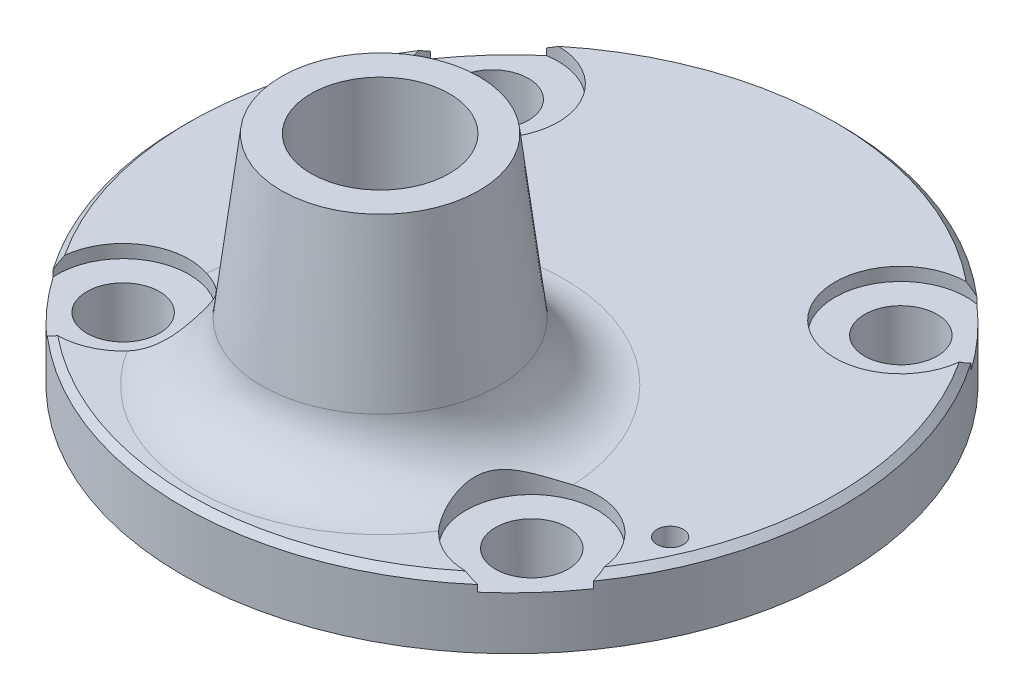
from build123d import *

# Parameters (mm, degrees)
SKETCH_1_R               = 50
EXTRUDE_1_DEPTH          = 10
FILLET_1_R               = 10
F_1_UN_DEPTH             = 79.0320447
F_1_UN_DEPTH_BACK        = 2
SKETCH_2_R               = 10
SKETCH_2_R_2             = 5.5
CUT_EXTRUDE_3_DEPTH      = 79.0320447
CUT_EXTRUDE_3_DEPTH_BACK = 79.0320447
SKETCH_2_3_R             = 5.5
SKETCH_6_R               = 10.5
CUT_EXTRUDE_4_DEPTH      = 83.758685345
SKETCH_7_R               = 2
CUT_EXTRUDE_6_DEPTH      = 83.758685345
CUT_EXTRUDE_7_DEPTH      = 4
SWEEP_1_OUTLINE_W        = 1.5
SWEEP_1_OUTLINE_H        = 22.476650491
CHAMFER_2_SIZE           = 1


# Read off the part's stored shape, not the designer's step: 切除-扫描1
with BuildPart() as part:
    # 草图1 → 凸台-拉伸1 (new body)
    with BuildSketch(Plane(origin=(0, 0, 0), x_dir=(1, 0, 0), z_dir=(0, 1, 0))):
        with Locations(Location((0, 0, 0), (0, 0, 270))):
            Circle(SKETCH_1_R)
    extrude(amount=EXTRUDE_1_DEPTH)

    # 草图5 → 旋转1 (revolve)
    with BuildSketch(Plane(origin=(0, 0, 0), x_dir=(0, 0, -1), z_dir=(1, 0, 0))):
        Polygon((-20, 10), (-20, 43), (-35, 43), (-39, 10), align=None)
    revolve(axis=Axis((0, 37.278151035, 20), (0, -1, 0)))

    # 圆角1
    fillet_1_edges = [part.edges().sort_by_distance(p)[0] for p in [
        (0, 10, 1),
    ]]
    fillet(fillet_1_edges, radius=FILLET_1_R)

    # 草图2 → 切除-拉伸1 un (cut, two sides: drawn at the far end of the back side and taken through both)
    # profile 1 of 4: a face of its own
    with BuildSketch(Plane(origin=(0, 10, 0), x_dir=(1, 0, 0), z_dir=(0, 1, 0)).offset(-F_1_UN_DEPTH_BACK)):
        with Locations((31, 28)):
            Circle(SKETCH_2_R)
        with Locations(Location((31, 28, 0), (0, 0, 270))):
            Circle(SKETCH_2_R_2, mode=Mode.SUBTRACT)
    # profile 2 of 4: a face of its own
    with BuildSketch(Plane(origin=(0, 10, 0), x_dir=(1, 0, 0), z_dir=(0, 1, 0)).offset(-F_1_UN_DEPTH_BACK)):
        with Locations((-31, 28)):
            Circle(SKETCH_2_R)
        with Locations(Location((-31, 28, 0), (0, 0, 90))):
            Circle(SKETCH_2_R_2, mode=Mode.SUBTRACT)
    # profile 3 of 4: a face of its own
    with BuildSketch(Plane(origin=(0, 10, 0), x_dir=(1, 0, 0), z_dir=(0, 1, 0)).offset(-F_1_UN_DEPTH_BACK)):
        with Locations((-31, -28)):
            Circle(SKETCH_2_R)
        with Locations(Location((-31, -28, 0), (0, 0, 52.073353544))):
            Circle(SKETCH_2_R_2, mode=Mode.SUBTRACT)
    # profile 4 of 4: a face of its own
    with BuildSketch(Plane(origin=(0, 10, 0), x_dir=(1, 0, 0), z_dir=(0, 1, 0)).offset(-F_1_UN_DEPTH_BACK)):
        with Locations((31, -28)):
            Circle(SKETCH_2_R)
        with Locations(Location((31, -28, 0), (0, 0, 90))):
            Circle(SKETCH_2_R_2, mode=Mode.SUBTRACT)
    extrude(amount=F_1_UN_DEPTH + F_1_UN_DEPTH_BACK, mode=Mode.SUBTRACT)

    # 草图2<3> → 切除-拉伸3 (cut, two sides: drawn at the far end of the back side and taken through both)
    with BuildSketch(Plane(origin=(0, 10, 0), x_dir=(1, 0, 0), z_dir=(0, 1, 0)).offset(-CUT_EXTRUDE_3_DEPTH_BACK)):
        with Locations(Location((31, 28, 0), (0, 0, 270))):
            Circle(SKETCH_2_3_R)
        with Locations(Location((-31, 28, 0), (0, 0, 270))):
            Circle(SKETCH_2_3_R)
        with Locations(Location((-31, -28, 0), (0, 0, 270))):
            Circle(SKETCH_2_3_R)
        with Locations(Location((31, -28, 0), (0, 0, 270))):
            Circle(SKETCH_2_3_R)
    extrude(amount=CUT_EXTRUDE_3_DEPTH + CUT_EXTRUDE_3_DEPTH_BACK, mode=Mode.SUBTRACT)

    # 草图6 → 切除-拉伸4 (cut, through all)
    with BuildSketch(Plane(origin=(0, 43, 0), x_dir=(1, 0, 0), z_dir=(0, 1, 0))):
        with Locations(Location((0, -20, 0), (0, 0, 270))):
            Circle(SKETCH_6_R)
    extrude(amount=-CUT_EXTRUDE_4_DEPTH, mode=Mode.SUBTRACT)

    # 草图7 → 切除-拉伸6 (cut, through all)
    with BuildSketch(Plane(origin=(0, 0, 0), x_dir=(1, 0, 0), z_dir=(0, 1, 0))):
        with Locations(Location((42, -18, 0), (0, 0, 270))):
            Circle(SKETCH_7_R)
        with Locations(Location((-42, 18, 0), (0, 0, 270))):
            Circle(SKETCH_7_R)
    extrude(amount=CUT_EXTRUDE_6_DEPTH, mode=Mode.SUBTRACT)

    # 草图8 → 切除-拉伸7 (cut)
    with BuildSketch(Plane.XZ):
        with BuildLine():
            Line((0, -5), (-10, -5))
            ThreePointArc((-10, -5), (-15, 0), (-10, 5))
            Line((-10, 5), (0, 5))
            ThreePointArc((0, 5), (5, 0), (0, -5))
        make_face()
    extrude(amount=-CUT_EXTRUDE_7_DEPTH, mode=Mode.SUBTRACT)

    # 切除-扫描1 outline → 切除-扫描1 (revolve, cut)
    with BuildSketch(Plane(origin=(0, 1, -1.732050808), x_dir=(1, 0, 0), z_dir=(0, -0.5000000000000042, 0.8660254037844363))):
        with Locations((0.75, 13.824548036)):
            Rectangle(SWEEP_1_OUTLINE_W, SWEEP_1_OUTLINE_H)
    revolve(axis=Axis((0, 1, -1.732050808), (0, 0.8660254037844363, 0.5000000000000042)), mode=Mode.SUBTRACT)

    # 倒角2
    chamfer_2_edges = [part.edges().sort_by_distance(p)[0] for p in [
        (50, 10, 0),
        (0, 10, -50),
        (-50, 10, 0),
        (17.420003831, 10, 46.867296343),
    ]]
    chamfer(chamfer_2_edges, length=CHAMFER_2_SIZE)


solid = part.part
